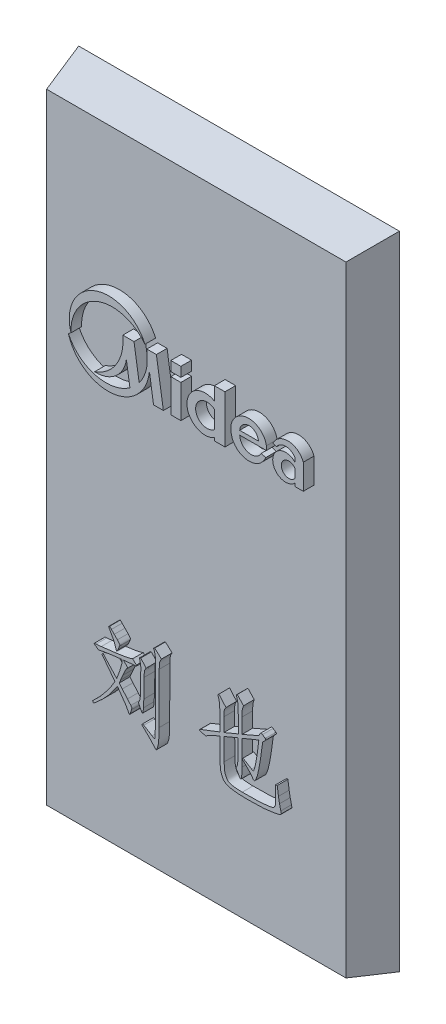
from build123d import *

# Parameters (mm, degrees)
EXTRUDE_3_DEPTH     = 1
SKETCH_5_R          = 5.5
CUT_EXTRUDE_1_DEPTH = 2
EXTRUDE_4_DEPTH     = 1
SKETCH_8_W          = 0.942568697
SKETCH_8_H          = 0.898055065
SKETCH_8_H_2        = 3.095520825
EXTRUDE_5_DEPTH     = 1


with BuildPart() as part:
    # 草图1 → 放样1 section 0
    with BuildSketch(Plane.XY):
        with BuildLine():
            Line((-15, -30), (15, -30))
            Line((15, -30), (15, 30))
            Line((15, 30), (-15, 30))
            Line((-15, 30), (-15, -30))
        make_face()
    # 草图2 → 放样1 section 1
    with BuildSketch(Plane.XY.offset(4)):
        with BuildLine():
            Line((-14, -29), (14, -29))
            Line((14, -29), (14, 29))
            Line((14, 29), (-14, 29))
            Line((-14, 29), (-14, -29))
        make_face()
    loft()

    # 草图4 → 凸台-拉伸3 (add)
    with BuildSketch(Plane.XY.offset(4)):
        with BuildLine():
            Line((-8.701981675, -17.388663968), (-8.617600682, -17.301725975))
            add(Edge.make_bspline(
                [(-8.617600682, -17.301725975), (-8.6150409, -17.299171838), (-8.607361553, -17.291509428), (-8.591939025, -17.275812111), (-8.567531532, -17.253359072), (-8.535647603, -17.222146979), (-8.494553267, -17.183979196), (-8.445204463, -17.138285053), (-8.386816782, -17.085481715), (-8.320576955, -17.024306793), (-8.246221878, -16.954193648), (-8.165436054, -16.873388622), (-8.079020214, -16.781225902), (-7.985588416, -16.679014982), (-7.886121691, -16.565894731), (-7.778094687, -16.443997551), (-7.666436292, -16.308719395), (-7.503591424, -16.115000087), (-7.298895179, -15.854174622), (-7.06301416, -15.517669226), (-6.830626913, -15.160132218), (-6.685534688, -14.909472229), (-6.611634349, -14.781802685)],
                knots=[0, 0, 0, 0, 0.067064899, 0.201194698, 0.408053647, 0.681959008, 1.028641223, 1.448132034, 1.929283414, 2.488604495, 3.120354818, 3.824536261, 4.607279378, 5.463251305, 6.392664243, 7.400870751, 8.483674113, 9.645406679, 12.094487374, 14.629448405, 17.264597856, 20, 20, 20, 20], degree=3))
            add(Edge.make_bspline(
                [(-6.611634349, -14.781802685), (-6.677355219, -14.694080325), (-6.801336137, -14.528594101), (-6.975046697, -14.293869871), (-7.128052851, -14.089741633), (-7.260480444, -13.915569528), (-7.369897523, -13.770279599), (-7.457376329, -13.654282983), (-7.526217285, -13.570571896), (-7.582699071, -13.497799136), (-7.635586412, -13.437186854), (-7.679234592, -13.378243521), (-7.712283472, -13.338932475), (-7.724576877, -13.315079833), (-7.729043256, -13.306413808)],
                knots=[0, 0, 0, 0, 2.13149326, 4.021013283, 5.678471046, 7.092298062, 8.275727547, 9.215558715, 9.917047241, 10.382981583, 11.006899411, 11.479347563, 11.810839116, 12, 12, 12, 12], degree=3))
            Line((-7.729043256, -13.306413808), (-7.824930748, -13.177285319))
            Line((-7.824930748, -13.177285319), (-7.729043256, -13.073726827))
            Line((-7.729043256, -13.073726827), (-7.644662263, -13.15938632))
            add(Edge.make_bspline(
                [(-7.644662263, -13.15938632), (-7.629282451, -13.175972122), (-7.591954382, -13.216227229), (-7.527305195, -13.288297956), (-7.440557184, -13.379422665), (-7.302378255, -13.536292511), (-7.104572099, -13.745740062), (-6.905065826, -13.963796689), (-6.747802954, -14.136718021), (-6.635049858, -14.252099447), (-6.536865705, -14.358806964), (-6.47286159, -14.423973045), (-6.442872363, -14.454506712)],
                knots=[0, 0, 0, 0, 0.384045172, 0.932109217, 1.643764177, 2.519898478, 4.481024401, 6.534588103, 7.538259206, 8.449228042, 9.273383417, 10, 10, 10, 10], degree=3))
            add(Edge.make_bspline(
                [(-6.442872363, -14.454506712), (-6.405201527, -14.35911478), (-6.332905522, -14.176043302), (-6.231843181, -13.912276932), (-6.149864716, -13.668866252), (-6.078665366, -13.450308489), (-6.024339358, -13.258168598), (-5.98424666, -13.096326335), (-5.956943752, -12.966798323), (-5.95252254, -12.890132643), (-5.950649904, -12.857660345)],
                knots=[0, 0, 0, 0, 1.468618142, 2.818499293, 4.043910366, 5.145864078, 6.10981738, 6.901638294, 7.534781031, 8, 8, 8, 8], degree=3))
            Line((-5.950649904, -12.857660345), (-5.950649904, -12.667163861))
            Line((-5.950649904, -12.667163861), (-6.972171319, -12.788621351))
            Line((-6.972171319, -12.788621351), (-7.451608779, -12.857660345))
            Line((-7.451608779, -12.857660345), (-7.956616237, -12.952269337))
            Line((-7.956616237, -12.952269337), (-8.16117622, -12.995738334))
            Line((-8.16117622, -12.995738334), (-8.232772214, -12.935648839))
            Line((-8.232772214, -12.935648839), (-8.485915193, -12.745152355))
            add(Edge.make_bspline(
                [(-8.485915193, -12.745152355), (-8.501489303, -12.73490888), (-8.526447886, -12.718493008), (-8.558458879, -12.694799587), (-8.557568147, -12.661889169), (-8.50827822, -12.649271695), (-8.449453901, -12.63496461), (-8.393937078, -12.628338983), (-8.365736203, -12.624973365)],
                knots=[0, 0, 0, 0, 1.118768377, 1.792903396, 2.169548065, 2.763492425, 4.355951528, 6, 6, 6, 6], degree=3))
            Line((-8.365736203, -12.624973365), (-7.885020243, -12.590453867))
            add(Edge.make_bspline(
                [(-7.885020243, -12.590453867), (-7.78272737, -12.578629672), (-7.574258285, -12.5545324), (-7.256024754, -12.515654208), (-6.925643087, -12.476441077), (-6.701543082, -12.448642762), (-6.587342851, -12.43447688)],
                knots=[0, 0, 0, 0, 0.945420497, 1.926731945, 2.943473063, 4, 4, 4, 4], degree=3))
            add(Edge.make_bspline(
                [(-6.587342851, -12.43447688), (-6.495657729, -12.423413493), (-6.318882537, -12.402082524), (-6.064664904, -12.364158296), (-5.830515798, -12.327688901), (-5.617264447, -12.28984122), (-5.424834911, -12.249462361), (-5.25244094, -12.211336739), (-5.101225844, -12.169009917), (-5.008293553, -12.13818563), (-4.964926486, -12.123801406)],
                knots=[0, 0, 0, 0, 1.33948248, 2.582613925, 3.727962399, 4.776813962, 5.723648299, 6.579883267, 7.337299279, 8, 8, 8, 8], degree=3))
            Line((-4.964926486, -12.123801406), (-4.592883017, -12.44342638))
            add(Edge.make_bspline(
                [(-4.592883017, -12.44342638), (-4.586313661, -12.454610374), (-4.573704208, -12.476077324), (-4.578676747, -12.511884126), (-4.596688819, -12.541911053), (-4.618071593, -12.545302265), (-4.628681014, -12.546984871)],
                knots=[0, 0, 0, 0, 1.123791349, 2.157044512, 3.08558681, 4, 4, 4, 4], degree=3))
            Line((-4.628681014, -12.546984871), (-5.193777967, -12.590453867))
            Line((-5.193777967, -12.590453867), (-5.793394417, -12.650543362))
            Line((-5.793394417, -12.650543362), (-5.409844449, -13.099296825))
            add(Edge.make_bspline(
                [(-5.409844449, -13.099296825), (-5.449499903, -13.136079122), (-5.524000558, -13.205181979), (-5.587303376, -13.301744233), (-5.61998484, -13.37159487), (-5.641445696, -13.416701743), (-5.666890063, -13.471734749), (-5.696865722, -13.536256466), (-5.729756683, -13.61142488), (-5.766306518, -13.697074488), (-5.809177744, -13.791622756), (-5.838230924, -13.858260359), (-5.853483912, -13.893245259)],
                knots=[0, 0, 0, 0, 1.762639404, 3.311468555, 3.728776672, 4.283189535, 4.943599157, 5.710021754, 6.607881863, 7.624557154, 8.752886879, 10, 10, 10, 10], degree=3))
            Line((-5.853483912, -13.893245259), (-6.082335393, -14.411037716))
            Line((-6.082335393, -14.411037716), (-6.214020882, -14.712763691))
            Line((-6.214020882, -14.712763691), (-5.926358406, -15.049009163))
            Line((-5.926358406, -15.049009163), (-5.434135947, -15.610270616))
            Line((-5.434135947, -15.610270616), (-5.120903473, -15.973364586))
            add(Edge.make_bspline(
                [(-5.120903473, -15.973364586), (-5.108508398, -15.990363114), (-5.086163173, -16.021007216), (-5.056993841, -16.062275096), (-5.040222812, -16.096032898), (-5.029672316, -16.123584455), (-5.031655384, -16.152962114), (-5.034721662, -16.189376311), (-5.04632312, -16.236994653), (-5.055631797, -16.272143528), (-5.060813978, -16.291711059)],
                knots=[0, 0, 0, 0, 1.455215602, 2.623390349, 3.479583614, 4.066449285, 4.626074215, 5.48479686, 6.599775501, 8, 8, 8, 8], degree=3))
            Line((-5.060813978, -16.291711059), (-5.169486469, -16.663754528))
            add(Edge.make_bspline(
                [(-5.169486469, -16.663754528), (-5.174174993, -16.677157718), (-5.18246774, -16.700864381), (-5.198745873, -16.729886481), (-5.216901029, -16.749122095), (-5.238951481, -16.755125572), (-5.261594893, -16.748983909), (-5.282282348, -16.729450325), (-5.305362329, -16.7015698), (-5.3182664, -16.677293999), (-5.325463456, -16.663754528)],
                knots=[0, 0, 0, 0, 1.365122435, 2.414536923, 3.199116316, 3.836643909, 4.513934304, 5.360547298, 6.527884014, 8, 8, 8, 8], degree=3))
            Line((-5.325463456, -16.663754528), (-5.421350948, -16.482207543))
            Line((-5.421350948, -16.482207543), (-5.565821436, -16.215001065))
            add(Edge.make_bspline(
                [(-5.565821436, -16.215001065), (-5.572208548, -16.205622117), (-5.588244401, -16.182074784), (-5.616983427, -16.140250866), (-5.658060685, -16.086621593), (-5.705063521, -16.017726276), (-5.763659301, -15.936783591), (-5.830878889, -15.842211073), (-5.90903839, -15.735248117), (-5.992876265, -15.619552174), (-6.075177782, -15.503789732), (-6.150436469, -15.397555707), (-6.216408063, -15.305904078), (-6.26928579, -15.226623912), (-6.312977006, -15.16243407), (-6.347040873, -15.11293019), (-6.368573488, -15.076247309), (-6.378991259, -15.056277349), (-6.382782868, -15.049009163)],
                knots=[0, 0, 0, 0, 0.382459276, 0.960224421, 1.710024245, 2.658454337, 3.770494442, 5.077894009, 6.569008607, 8.235429148, 9.893471766, 11.356158959, 12.623493842, 13.699131709, 14.567622413, 15.240873571, 15.723711415, 16, 16, 16, 16], degree=3))
            add(Edge.make_bspline(
                [(-6.382782868, -15.049009163), (-6.416909498, -15.100552505), (-6.482944033, -15.200288127), (-6.578062572, -15.345140635), (-6.670026744, -15.477861724), (-6.753098386, -15.60222334), (-6.833596009, -15.714430579), (-6.905249148, -15.8183162), (-6.973635526, -15.91004722), (-7.058115277, -16.023697045), (-7.173217897, -16.167150414), (-7.334311928, -16.346177935), (-7.520572626, -16.54609202), (-7.728276888, -16.75445262), (-7.936900177, -16.959762036), (-8.134192485, -17.142216407), (-8.308601908, -17.29845862), (-8.42121459, -17.389077999), (-8.473130194, -17.430854464)],
                knots=[0, 0, 0, 0, 0.931745548, 1.802914179, 2.611776586, 3.365396291, 4.056858392, 4.693065683, 5.267339538, 5.781210556, 6.827513186, 8.037874439, 9.410316573, 10.945546555, 12.471773758, 13.821678912, 14.99577158, 16, 16, 16, 16], degree=3))
            Line((-8.473130194, -17.430854464), (-8.606094183, -17.534412955))
            Line((-8.606094183, -17.534412955), (-8.701981675, -17.388663968))
        make_face()
        with BuildLine():
            Line((-7.211250799, -10.630513531), (-7.103856808, -10.553803537))
            Line((-7.103856808, -10.553803537), (-6.935094822, -10.726401023))
            Line((-6.935094822, -10.726401023), (-6.671723844, -10.993607501))
            Line((-6.671723844, -10.993607501), (-6.382782868, -11.295333475))
            add(Edge.make_bspline(
                [(-6.382782868, -11.295333475), (-6.364016122, -11.315776091), (-6.328925502, -11.354000303), (-6.279962873, -11.407778928), (-6.238808393, -11.454933426), (-6.206100395, -11.495820497), (-6.179781755, -11.528336484), (-6.163263547, -11.554924513), (-6.151359602, -11.573453422), (-6.145792904, -11.602262853), (-6.166926085, -11.650051026), (-6.181777032, -11.692273105), (-6.191007884, -11.71851694)],
                knots=[0, 0, 0, 0, 1.619185606, 3.027601398, 4.244025609, 5.269295413, 6.084975465, 6.67813271, 7.10086228, 7.354451259, 8.355615234, 10, 10, 10, 10], degree=3))
            Line((-6.191007884, -11.71851694), (-6.311186874, -12.029192414))
            add(Edge.make_bspline(
                [(-6.311186874, -12.029192414), (-6.321417975, -12.053246865), (-6.339637715, -12.096083488), (-6.369175367, -12.150574851), (-6.394959287, -12.188922038), (-6.420692917, -12.212351984), (-6.449964905, -12.215095714), (-6.472643068, -12.194654532), (-6.489438739, -12.160245395), (-6.497947711, -12.131683057), (-6.502961858, -12.114851907)],
                knots=[0, 0, 0, 0, 1.766026744, 3.144973943, 4.176047435, 4.895969722, 5.415113065, 5.991050895, 6.816171035, 8, 8, 8, 8], degree=3))
            Line((-6.502961858, -12.114851907), (-6.527253356, -12.029192414))
            add(Edge.make_bspline(
                [(-6.527253356, -12.029192414), (-6.565462786, -11.913018959), (-6.64149182, -11.681857287), (-6.749621634, -11.463861832), (-6.803409333, -11.35542297)],
                knots=[0, 0, 0, 0, 1.005127315, 2, 2, 2, 2], degree=3))
            Line((-6.803409333, -11.35542297), (-6.972171319, -11.053696996))
            add(Edge.make_bspline(
                [(-6.972171319, -11.053696996), (-6.993300524, -11.01673679), (-7.030051629, -10.952450019), (-7.07406915, -10.869103457), (-7.103723446, -10.815099763), (-7.112566488, -10.786565613), (-7.115363307, -10.777541019)],
                knots=[0, 0, 0, 0, 1.639141311, 2.851042099, 3.636615117, 4, 4, 4, 4], degree=3))
            Line((-7.115363307, -10.777541019), (-7.211250799, -10.630513531))
        make_face()
        with BuildLine():
            Line((-4.31544854, -11.727466439), (-4.19526955, -11.675047944))
            Line((-4.19526955, -11.675047944), (-3.691540592, -12.245258896))
            add(Edge.make_bspline(
                [(-3.691540592, -12.245258896), (-3.709810323, -12.2727357), (-3.743306609, -12.323112515), (-3.783569559, -12.394330478), (-3.813704395, -12.452101199), (-3.834694025, -12.516023227), (-3.847448468, -12.59699214), (-3.86001522, -12.684347934), (-3.866041286, -12.771519098), (-3.870153354, -12.858037951), (-3.87038165, -12.963355521), (-3.871309223, -13.040061953), (-3.871809077, -13.081397827)],
                knots=[0, 0, 0, 0, 1.131244594, 2.0740586, 2.806258543, 3.36096166, 4.37296763, 5.611338802, 6.388280779, 7.368648685, 8.582006723, 10, 10, 10, 10], degree=3))
            Line((-3.871809077, -13.081397827), (-3.907607074, -14.859791178))
            Line((-3.907607074, -14.859791178), (-3.943405071, -15.584700618))
            add(Edge.make_bspline(
                [(-3.943405071, -15.584700618), (-3.945337151, -15.617956796), (-3.948981312, -15.680682431), (-3.95706597, -15.768414138), (-3.964171003, -15.844825772), (-3.973350685, -15.90913213), (-3.981514107, -15.961795872), (-3.991691865, -16.002621639), (-4.002479425, -16.031402593), (-4.01557264, -16.054962993), (-4.04649104, -16.064029303), (-4.079703401, -16.034802266), (-4.114163474, -15.988274594), (-4.135459361, -15.945855862), (-4.147965054, -15.92094609)],
                knots=[0, 0, 0, 0, 1.76302463, 3.325302124, 4.663004508, 5.824175704, 6.762377734, 7.484540761, 8.041647273, 8.39829817, 8.869293458, 9.507688602, 10.536427081, 12, 12, 12, 12], degree=3))
            Line((-4.147965054, -15.92094609), (-4.255359045, -15.713829107))
            Line((-4.255359045, -15.713829107), (-4.352525037, -15.532282122))
            add(Edge.make_bspline(
                [(-4.352525037, -15.532282122), (-4.365405618, -15.507749536), (-4.386757968, -15.467081464), (-4.402824564, -15.412835847), (-4.395966719, -15.373877463), (-4.383846398, -15.34036551), (-4.365738625, -15.298101457), (-4.326896416, -15.231664451), (-4.282712631, -15.130473075), (-4.25294185, -14.987201603), (-4.235786887, -14.823160753), (-4.233540193, -14.705998092), (-4.232346047, -14.643724696)],
                knots=[0, 0, 0, 0, 0.901925096, 1.495136018, 1.774437093, 2.167492218, 2.649873968, 3.26160492, 4.659748266, 6.204185153, 7.982477734, 10, 10, 10, 10], degree=3))
            Line((-4.232346047, -14.643724696), (-4.19526955, -12.814191349))
            Line((-4.19526955, -12.814191349), (-4.183763051, -12.44342638))
            add(Edge.make_bspline(
                [(-4.183763051, -12.44342638), (-4.18831572, -12.402924774), (-4.198826597, -12.309417557), (-4.215744817, -12.184916485), (-4.235127336, -12.066005847), (-4.255291323, -11.96181072), (-4.282481032, -11.84759475), (-4.304121749, -11.768739449), (-4.31544854, -11.727466439)],
                knots=[0, 0, 0, 0, 1.006347927, 2.323384265, 3.101860361, 3.981004873, 4.943254252, 6, 6, 6, 6], degree=3))
        make_face()
        with BuildLine():
            Line((-2.886085659, -10.216279565), (-2.260899212, -10.795440017))
            add(Edge.make_bspline(
                [(-2.260899212, -10.795440017), (-2.27897721, -10.825593177), (-2.31186996, -10.88045657), (-2.353740762, -10.955684025), (-2.385079585, -11.013972945), (-2.406156719, -11.061201132), (-2.418307524, -11.107926684), (-2.429878104, -11.162874149), (-2.439530387, -11.231674601), (-2.451791638, -11.345356064), (-2.462447745, -11.509089806), (-2.464411029, -11.645623695), (-2.465459195, -11.71851694)],
                knots=[0, 0, 0, 0, 1.09355359, 1.989710599, 2.677512757, 3.152714002, 3.593377568, 4.175755165, 4.899414449, 5.752884475, 7.732533383, 10, 10, 10, 10], degree=3))
            Line((-2.465459195, -11.71851694), (-2.489750693, -16.464308545))
            add(Edge.make_bspline(
                [(-2.489750693, -16.464308545), (-2.489682191, -16.492009645), (-2.489529374, -16.553807072), (-2.490975351, -16.656519076), (-2.4938808, -16.778813349), (-2.496965577, -16.96890006), (-2.502164021, -17.223356379), (-2.509750918, -17.482641294), (-2.523924139, -17.690403365), (-2.543112578, -17.841690607), (-2.577602355, -17.986608757), (-2.61808336, -18.120197835), (-2.659407718, -18.233941254), (-2.695694125, -18.314965002), (-2.715146911, -18.36969669), (-2.735761473, -18.38529897), (-2.741615172, -18.389729384)],
                knots=[0, 0, 0, 0, 0.591697287, 1.319996994, 2.194077997, 3.204678908, 5.380780365, 7.630722164, 8.744310266, 9.828297922, 10.883818306, 11.920525732, 12.813365975, 13.454079988, 13.844980897, 14, 14, 14, 14], degree=3))
            add(Edge.make_bspline(
                [(-2.741615172, -18.389729384), (-2.748580604, -18.386552763), (-2.770203473, -18.376691542), (-2.805730246, -18.342781364), (-2.857676356, -18.290296374), (-2.898439287, -18.248716896), (-2.921883657, -18.224802898)],
                knots=[0, 0, 0, 0, 0.372665578, 1.156869871, 2.364803703, 4, 4, 4, 4], degree=3))
            Line((-2.921883657, -18.224802898), (-3.35529512, -17.750479437))
            Line((-3.35529512, -17.750479437), (-3.967696569, -17.154698487))
            Line((-3.967696569, -17.154698487), (-4.099382058, -17.008949499))
            Line((-4.099382058, -17.008949499), (-4.003494566, -16.905391008))
            Line((-4.003494566, -16.905391008), (-3.907607074, -16.974430002))
            Line((-3.907607074, -16.974430002), (-3.137950139, -17.448753463))
            add(Edge.make_bspline(
                [(-3.137950139, -17.448753463), (-3.107846641, -17.467453432), (-3.055614578, -17.499899429), (-2.987095797, -17.54194895), (-2.943047018, -17.562424533), (-2.912447329, -17.578564787), (-2.894380813, -17.563642034), (-2.884389813, -17.541037572), (-2.870955086, -17.507974371), (-2.865124564, -17.480861102), (-2.861794162, -17.465373961)],
                knots=[0, 0, 0, 0, 2.231975484, 3.872662471, 4.948167798, 5.447359977, 5.773533116, 6.264068126, 7.008433082, 8, 8, 8, 8], degree=3))
            add(Edge.make_bspline(
                [(-2.861794162, -17.465373961), (-2.858514906, -17.447512726), (-2.850750002, -17.405219364), (-2.858581596, -17.328530112), (-2.859413733, -17.227473124), (-2.851781312, -17.137658333), (-2.847727937, -17.0638988), (-2.843092015, -17.012428916), (-2.84163978, -16.949676316), (-2.836799089, -16.876886425), (-2.834870732, -16.792882265), (-2.832612814, -16.698680605), (-2.827953876, -16.593893276), (-2.826668572, -16.520567804), (-2.825996165, -16.482207543)],
                knots=[0, 0, 0, 0, 0.661127957, 1.565475392, 2.796625909, 4.357721855, 4.857348772, 5.497957161, 6.246587067, 7.151605532, 8.164975693, 9.318533995, 10.597189571, 12, 12, 12, 12], degree=3))
            Line((-2.825996165, -16.482207543), (-2.801704667, -11.545919455))
            add(Edge.make_bspline(
                [(-2.801704667, -11.545919455), (-2.801760094, -11.519481806), (-2.801871949, -11.466129504), (-2.807924708, -11.396797206), (-2.810607971, -11.332810947), (-2.815391131, -11.270252602), (-2.816801137, -11.193025953), (-2.822487079, -11.073272995), (-2.829012882, -10.921239192), (-2.843980556, -10.769848285), (-2.868264302, -10.646533474), (-2.89965208, -10.540449213), (-2.942670187, -10.417885881), (-2.976551583, -10.331655482), (-2.99475815, -10.28531856)],
                knots=[0, 0, 0, 0, 0.739991118, 1.493333668, 1.947445289, 2.533295858, 3.249720848, 4.109699155, 5.890394751, 7.51137051, 8.363279193, 9.405830689, 10.605992517, 12, 12, 12, 12], degree=3))
            Line((-2.99475815, -10.28531856), (-2.886085659, -10.216279565))
        make_face()
        with BuildLine():
            Line((3.210824632, -13.962284253), (3.210824632, -12.374387385))
            add(Edge.make_bspline(
                [(3.210824632, -12.374387385), (3.209126434, -12.271656981), (3.205655579, -12.06169196), (3.187606357, -11.795820456), (3.159876337, -11.575337912), (3.126662955, -11.402164237), (3.07905803, -11.224205556), (3.038507103, -11.105465778), (3.017771149, -11.044747496)],
                knots=[0, 0, 0, 0, 1.368881025, 2.797780605, 3.547867927, 4.328518173, 5.145277974, 6, 6, 6, 6], degree=3))
            Line((3.017771149, -11.044747496), (3.11493714, -10.941189005))
            Line((3.11493714, -10.941189005), (3.774643085, -11.700617942))
            add(Edge.make_bspline(
                [(3.774643085, -11.700617942), (3.758326503, -11.725251518), (3.72796582, -11.771087843), (3.687480246, -11.836093473), (3.657878594, -11.893945094), (3.627944587, -11.964767706), (3.607082509, -12.067445774), (3.592483254, -12.208639878), (3.584038135, -12.372591178), (3.583265573, -12.487741703), (3.582868101, -12.546984871)],
                knots=[0, 0, 0, 0, 0.799333978, 1.487341208, 2.069922442, 2.555870397, 3.562491356, 4.885176502, 6.397471374, 8, 8, 8, 8], degree=3))
            Line((3.582868101, -12.546984871), (3.582868101, -13.824206265))
            Line((3.582868101, -13.824206265), (4.929128489, -13.262944811))
            Line((4.929128489, -13.262944811), (4.929128489, -11.753036437))
            add(Edge.make_bspline(
                [(4.929128489, -11.753036437), (4.92858556, -11.691244836), (4.927548375, -11.573201294), (4.927892338, -11.404804507), (4.921425798, -11.253992254), (4.915833818, -11.079927224), (4.901987045, -10.885380488), (4.875754526, -10.70123617), (4.846282377, -10.559098647), (4.815991848, -10.44684633), (4.781186889, -10.325153143), (4.751489744, -10.242540414), (4.736075005, -10.199659067)],
                knots=[0, 0, 0, 0, 1.176911092, 2.248311282, 3.206600744, 4.051334116, 5.565261425, 6.918565952, 7.590320494, 8.328559244, 9.132414199, 10, 10, 10, 10], degree=3))
            Line((4.736075005, -10.199659067), (4.831962497, -10.112721074))
            Line((4.831962497, -10.112721074), (5.421350948, -10.734072022))
            add(Edge.make_bspline(
                [(5.421350948, -10.734072022), (5.408322526, -10.770211237), (5.383317544, -10.839571927), (5.351239432, -10.940628433), (5.325704556, -11.034024238), (5.303827308, -11.126182054), (5.29141719, -11.231984471), (5.283519325, -11.364266474), (5.276614903, -11.530086504), (5.276786754, -11.652026137), (5.27688046, -11.71851694)],
                knots=[0, 0, 0, 0, 0.919393691, 1.76455914, 2.536580374, 3.236881176, 4.028858006, 5.081856361, 6.408805183, 8, 8, 8, 8], degree=3))
            Line((5.27688046, -11.71851694), (5.27688046, -13.124866823))
            Line((5.27688046, -13.124866823), (6.827700831, -12.452375879))
            Line((6.827700831, -12.452375879), (7.019475815, -12.158320903))
            add(Edge.make_bspline(
                [(7.019475815, -12.158320903), (7.026703946, -12.148697104), (7.041507275, -12.128987408), (7.086030215, -12.128122667), (7.134752872, -12.147887327), (7.168626298, -12.170689347), (7.188237801, -12.183890901)],
                knots=[0, 0, 0, 0, 0.71453755, 1.463384476, 2.53139035, 4, 4, 4, 4], degree=3))
            Line((7.188237801, -12.183890901), (7.44010228, -12.374387385))
            add(Edge.make_bspline(
                [(7.44010228, -12.374387385), (7.456409708, -12.388950822), (7.484511329, -12.414047126), (7.499338251, -12.463386598), (7.482078066, -12.498937399), (7.458599113, -12.532898791), (7.416909429, -12.570821509), (7.368574387, -12.61700621), (7.316558293, -12.66066125), (7.273659526, -12.702873709), (7.241348343, -12.736242921), (7.21701738, -12.763028278), (7.208110051, -12.796607746), (7.197737652, -12.840710682), (7.1853454, -12.906928354), (7.171491916, -12.995155013), (7.156693918, -13.104841442), (7.138517192, -13.236055278), (7.117949326, -13.388985313), (7.090185505, -13.615805341), (7.057078191, -13.895783521), (7.012200307, -14.20829562), (6.973202819, -14.482784302), (6.930564858, -14.72147271), (6.891685116, -14.932838148), (6.854222441, -15.124032539), (6.8204412, -15.299942354), (6.785589875, -15.460139588), (6.75147321, -15.607093542), (6.714601925, -15.742081558), (6.673630702, -15.866106051), (6.630965981, -15.977511831), (6.590073801, -16.073390324), (6.556322534, -16.151155796), (6.52798116, -16.209509469), (6.502502392, -16.25649485), (6.470291137, -16.298824211), (6.434831686, -16.300083455), (6.418580865, -16.300660558)],
                knots=[0, 0, 0, 0, 0.559111769, 0.963484084, 1.199679221, 1.54642562, 2.027141703, 2.640108529, 3.269336219, 3.773372396, 4.184380251, 4.473866774, 4.681914613, 5.06490853, 5.645540527, 6.411685309, 7.363818343, 8.492742829, 9.820197465, 11.333935145, 14.372292433, 17.073622702, 19.457084914, 21.504944609, 23.311490023, 24.986709407, 26.517821523, 27.920066707, 29.204667356, 30.399106788, 31.519103026, 32.563782659, 33.467986644, 34.199448975, 34.748689143, 35.126785844, 35.59981199, 36, 36, 36, 36], degree=3))
            add(Edge.make_bspline(
                [(6.418580865, -16.300660558), (6.409816095, -16.299120895), (6.389730733, -16.2955926), (6.361018096, -16.272946221), (6.329957172, -16.239895489), (6.309607694, -16.212298734), (6.298401875, -16.197102067)],
                knots=[0, 0, 0, 0, 0.646680353, 1.481933883, 2.613379931, 4, 4, 4, 4], degree=3))
            Line((6.298401875, -16.197102067), (5.973662902, -15.791817601))
            Line((5.973662902, -15.791817601), (5.613125932, -15.421052632))
            Line((5.613125932, -15.421052632), (5.301171958, -15.126997656))
            Line((5.301171958, -15.126997656), (5.372767952, -14.997869167))
            Line((5.372767952, -14.997869167), (6.178222885, -15.490091626))
            add(Edge.make_bspline(
                [(6.178222885, -15.490091626), (6.194648608, -15.501452728), (6.223636396, -15.521502575), (6.263939359, -15.544300169), (6.292140741, -15.559916984), (6.316588627, -15.565606088), (6.337826073, -15.551900936), (6.356216812, -15.525312045), (6.377768277, -15.484375663), (6.405013145, -15.426588416), (6.435086831, -15.342078206), (6.466498512, -15.224546279), (6.505581258, -15.071791979), (6.559629335, -14.822391743), (6.627938588, -14.494438642), (6.679128713, -14.166876704), (6.712451994, -13.922564919), (6.736216622, -13.763771542), (6.754851776, -13.626833399), (6.773152012, -13.502512968), (6.791650807, -13.370998623), (6.808587871, -13.212279497), (6.829172257, -13.017111291), (6.843144072, -12.874717856), (6.850713829, -12.79757085)],
                knots=[0, 0, 0, 0, 0.440323242, 0.777073662, 1.016577932, 1.15873692, 1.297439592, 1.538046727, 1.870179391, 2.315683085, 2.945720451, 3.843830757, 4.996709113, 6.421182702, 9.468416178, 12.379641864, 13.726774567, 14.903855726, 15.918856624, 16.773102867, 17.673862327, 18.846135373, 20.291275087, 22, 22, 22, 22], degree=3))
            Line((6.850713829, -12.79757085), (5.265373961, -13.444491796))
            Line((5.265373961, -13.444491796), (5.265373961, -15.791817601))
            add(Edge.make_bspline(
                [(5.265373961, -15.791817601), (5.265651609, -15.854466389), (5.266174824, -15.972525423), (5.262737996, -16.139142222), (5.260821378, -16.284490155), (5.256968943, -16.408939518), (5.252241525, -16.512134297), (5.245890952, -16.594396297), (5.239366722, -16.655676085), (5.228165992, -16.706277228), (5.212924944, -16.748283526), (5.195840814, -16.782707572), (5.178343387, -16.807366528), (5.163005445, -16.808881042), (5.15670147, -16.809503516)],
                knots=[0, 0, 0, 0, 2.150659061, 4.052827516, 5.720942216, 7.140763154, 8.327264278, 9.266458778, 9.974179908, 10.439139188, 11.045371919, 11.490336149, 11.790525499, 12, 12, 12, 12], degree=3))
            add(Edge.make_bspline(
                [(5.15670147, -16.809503516), (5.145084644, -16.806090327), (5.115477873, -16.797391438), (5.079860637, -16.750467384), (5.03411576, -16.687163889), (5.00555075, -16.633226562), (4.989217984, -16.602386533)],
                knots=[0, 0, 0, 0, 0.521855015, 1.330005405, 2.473363152, 4, 4, 4, 4], degree=3))
            Line((4.989217984, -16.602386533), (4.831962497, -16.318559557))
            add(Edge.make_bspline(
                [(4.831962497, -16.318559557), (4.816647756, -16.292605327), (4.789719584, -16.24696956), (4.754513798, -16.187356703), (4.736850566, -16.14424678), (4.726676087, -16.112382083), (4.737698822, -16.086419896), (4.74847026, -16.055251845), (4.766358044, -16.014895421), (4.792389019, -15.966324018), (4.818368235, -15.903962994), (4.840282152, -15.826694947), (4.859466062, -15.734353684), (4.874221519, -15.632559334), (4.888087211, -15.531143226), (4.897628983, -15.441089287), (4.906229205, -15.367479809), (4.910466321, -15.300917129), (4.912987062, -15.222899108), (4.915654365, -15.115933767), (4.916598437, -14.970595453), (4.916435041, -14.861069343), (4.91634349, -14.799701683)],
                knots=[0, 0, 0, 0, 1.153316831, 2.027896723, 2.626604535, 2.958707876, 3.24723816, 3.664596661, 4.233327129, 4.925102638, 5.771803346, 6.807388563, 7.988979107, 9.373009111, 10.736290758, 11.899678417, 12.832920397, 13.567268629, 14.447137605, 15.815272531, 17.655290347, 20, 20, 20, 20], degree=3))
            Line((4.91634349, -14.799701683), (4.91634349, -13.582569785))
            Line((4.91634349, -13.582569785), (3.5943746, -14.134881739))
            Line((3.5943746, -14.134881739), (3.607159599, -16.188152568))
            add(Edge.make_bspline(
                [(3.607159599, -16.188152568), (3.609155134, -16.284053774), (3.613328035, -16.484594624), (3.628018181, -16.739684973), (3.658403283, -16.954775715), (3.708894856, -17.120409554), (3.779909349, -17.287863294), (3.8493934, -17.431707783), (3.937255351, -17.541708253), (4.041768254, -17.608686369), (4.174288903, -17.66793349), (4.339417769, -17.712353392), (4.53435378, -17.751593078), (4.762088112, -17.774427082), (5.02090097, -17.7920111), (5.204392162, -17.793279457), (5.301171958, -17.793948434)],
                knots=[0, 0, 0, 0, 1.425456696, 2.980799826, 3.795017339, 4.646697254, 5.544056949, 6.498866747, 7.011340332, 7.612152063, 8.320781704, 9.164607943, 10.145811148, 11.273905285, 12.562160463, 14, 14, 14, 14], degree=3))
            add(Edge.make_bspline(
                [(5.301171958, -17.793948434), (5.470789115, -17.794515515), (5.804503094, -17.79563122), (6.297213468, -17.787554868), (6.774213208, -17.772892278), (7.15857007, -17.752473046), (7.447605944, -17.73307115), (7.6382032, -17.714011088), (7.8043043, -17.691920919), (7.945776182, -17.664672643), (8.063545394, -17.637033396), (8.156964339, -17.603728141), (8.228035826, -17.569073121), (8.286855914, -17.514670336), (8.330260992, -17.44272668), (8.374041165, -17.363231496), (8.402674496, -17.284695978), (8.409655582, -17.232450653), (8.413040699, -17.207116983)],
                knots=[0, 0, 0, 0, 2.420504351, 4.762231322, 7.03186758, 9.2303889, 10.254712443, 11.165461446, 11.963621161, 12.644686658, 13.221420043, 13.686975695, 14.059747789, 14.339570671, 14.816933281, 15.24945927, 15.636064052, 16, 16, 16, 16], degree=3))
            Line((8.413040699, -17.207116983), (8.425825698, -15.635840614))
            Line((8.425825698, -15.635840614), (8.569017686, -15.619220115))
            Line((8.569017686, -15.619220115), (8.689196676, -16.438738547))
            Line((8.689196676, -16.438738547), (8.786362668, -16.991050501))
            Line((8.786362668, -16.991050501), (8.906541658, -17.508842958))
            add(Edge.make_bspline(
                [(8.906541658, -17.508842958), (8.908298872, -17.526376634), (8.912419079, -17.567488534), (8.928010183, -17.628304071), (8.946344796, -17.68162792), (8.951917027, -17.713778718), (8.953846154, -17.72490944)],
                knots=[0, 0, 0, 0, 0.953220718, 2.235054002, 3.388969388, 4, 4, 4, 4], degree=3))
            add(Edge.make_bspline(
                [(8.953846154, -17.72490944), (8.950069463, -17.736983143), (8.941712863, -17.763698363), (8.904645101, -17.795045339), (8.856434737, -17.82724415), (8.789371367, -17.855267017), (8.707715764, -17.884867177), (8.608460275, -17.912549262), (8.492372402, -17.939047729), (8.317130483, -17.971835273), (8.091894188, -18.009785756), (7.825098208, -18.045368552), (7.569274082, -18.078985841), (7.359310107, -18.098316431), (7.186183001, -18.110551033), (7.041252135, -18.117909869), (6.879727276, -18.124408997), (6.70198161, -18.128874983), (6.507684288, -18.134990279), (6.29669265, -18.136283727), (6.069134417, -18.139943667), (5.911870583, -18.139416346), (5.830470914, -18.139143405)],
                knots=[0, 0, 0, 0, 0.232926519, 0.515391414, 0.878795428, 1.325768791, 1.869100865, 2.508894764, 3.255029941, 4.101143149, 5.850638678, 7.536402802, 9.14670046, 10.687374927, 11.488261288, 12.400303648, 13.407749454, 14.51872378, 15.733519881, 17.051853478, 18.474041082, 20, 20, 20, 20], degree=3))
            add(Edge.make_bspline(
                [(5.830470914, -18.139143405), (5.749499846, -18.139378112), (5.591382586, -18.13983644), (5.360320443, -18.136582645), (5.141722252, -18.126795164), (4.935319262, -18.116184546), (4.741261185, -18.099891372), (4.559842862, -18.07740414), (4.390691678, -18.054235165), (4.234594957, -18.024596436), (4.091014932, -17.991286754), (3.960984602, -17.94893976), (3.843915713, -17.899325014), (3.74012297, -17.84200252), (3.649680107, -17.778015545), (3.572517953, -17.706759318), (3.509301087, -17.627469309), (3.447456445, -17.513961696), (3.388881158, -17.37449272), (3.328227496, -17.217719964), (3.287009221, -17.074340979), (3.260759296, -16.939508324), (3.249330552, -16.801128193), (3.240759072, -16.64807565), (3.233684411, -16.473317947), (3.233784497, -16.349677339), (3.233837631, -16.28404006)],
                knots=[0, 0, 0, 0, 1.518911959, 2.966074195, 4.334239857, 5.623327299, 6.842892953, 7.986185861, 9.05230548, 10.044787367, 10.965795675, 11.815222499, 12.606695946, 13.347450692, 14.035144098, 14.679960432, 15.31171039, 15.927477056, 17.09794899, 18.147758735, 19.078945764, 19.892674845, 20.719956626, 21.68090022, 22.768855931, 24, 24, 24, 24], degree=3))
            Line((3.233837631, -16.28404006), (3.222331131, -14.289580226))
            add(Edge.make_bspline(
                [(3.222331131, -14.289580226), (3.159695497, -14.315601661), (3.040781697, -14.365003374), (2.871626836, -14.434819669), (2.722994747, -14.499134877), (2.593460017, -14.553589381), (2.484240181, -14.601604607), (2.394031785, -14.640580012), (2.323583949, -14.672308254), (2.254988923, -14.705658648), (2.17860888, -14.74665373), (2.088638186, -14.806853655), (1.989717119, -14.87517737), (1.923522055, -14.927171092), (1.888855743, -14.95440017)],
                knots=[0, 0, 0, 0, 1.631833046, 3.098036258, 4.40260852, 5.528124467, 6.478632526, 7.272971962, 7.892419543, 8.33722278, 9.108053839, 9.975462267, 10.9397509, 12, 12, 12, 12], degree=3))
            Line((1.888855743, -14.95440017), (1.383848285, -14.816322182))
            add(Edge.make_bspline(
                [(1.383848285, -14.816322182), (1.371256566, -14.813541672), (1.349110971, -14.808651471), (1.321910173, -14.794053216), (1.302807026, -14.775950203), (1.297801439, -14.751917852), (1.303225753, -14.727242926), (1.321967909, -14.705700487), (1.34822781, -14.684206509), (1.37110556, -14.674629187), (1.383848285, -14.669294694)],
                knots=[0, 0, 0, 0, 1.286068791, 2.261864203, 3.078608935, 3.825212105, 4.613490036, 5.528387975, 6.623331777, 8, 8, 8, 8], degree=3))
            Line((1.383848285, -14.669294694), (3.210824632, -13.962284253))
        make_face()
    extrude(amount=EXTRUDE_3_DEPTH)

    # 草图5 → 切除-拉伸1 (cut)
    with BuildSketch(Plane(origin=(0, 0, 0), x_dir=(-1, 0, 0), z_dir=(0, 0, -1))):
        Circle(SKETCH_5_R)
        with Locations((0, 18)):
            Circle(SKETCH_5_R)
        with Locations((0, -18)):
            Circle(SKETCH_5_R)
    extrude(amount=-CUT_EXTRUDE_1_DEPTH, mode=Mode.SUBTRACT)

    # 草图7 → 凸台-拉伸4 (add)
    with BuildSketch(Plane.XY.offset(4)):
        with BuildLine():
            Line((3.210824632, -13.962284253), (1.383848285, -14.669294694))
            add(Edge.make_bspline(
                [(1.383848285, -14.669294694), (1.37110556, -14.674629187), (1.34822781, -14.684206509), (1.321967909, -14.705700487), (1.303225753, -14.727242926), (1.297801439, -14.751917852), (1.302807026, -14.775950203), (1.321910173, -14.794053216), (1.349110971, -14.808651471), (1.371256566, -14.813541672), (1.383848285, -14.816322182)],
                knots=[0, 0, 0, 0, 0.172083528, 0.308951503, 0.423313745, 0.521848487, 0.615173883, 0.717266975, 0.839241401, 1, 1, 1, 1], degree=3))
            Line((1.383848285, -14.816322182), (1.888855743, -14.95440017))
            add(Edge.make_bspline(
                [(1.888855743, -14.95440017), (1.923522055, -14.927171092), (1.989717119, -14.87517737), (2.088638186, -14.806853655), (2.17860888, -14.74665373), (2.254988923, -14.705658648), (2.323583949, -14.672308254), (2.394031785, -14.640580012), (2.484240181, -14.601604607), (2.593460017, -14.553589381), (2.722994747, -14.499134877), (2.871626836, -14.434819669), (3.040781697, -14.365003374), (3.159695497, -14.315601661), (3.222331131, -14.289580226)],
                knots=[0, 0, 0, 0, 0.088354092, 0.168711478, 0.240995513, 0.305231435, 0.342298371, 0.393919003, 0.460113956, 0.539322961, 0.633115957, 0.741830312, 0.864013913, 1, 1, 1, 1], degree=3))
            Line((3.222331131, -14.289580226), (3.233837631, -16.28404006))
            add(Edge.make_bspline(
                [(3.233837631, -16.28404006), (3.233784497, -16.349677339), (3.233684411, -16.473317947), (3.240759072, -16.64807565), (3.249330552, -16.801128193), (3.260759296, -16.939508324), (3.287009221, -17.074340979), (3.328227496, -17.217719964), (3.388881158, -17.37449272), (3.447456445, -17.513961696), (3.509301087, -17.627469309), (3.572517953, -17.706759318), (3.649680107, -17.778015545), (3.74012297, -17.84200252), (3.843915713, -17.899325014), (3.960984602, -17.94893976), (4.091014932, -17.991286754), (4.234594957, -18.024596436), (4.390691678, -18.054235165), (4.559842862, -18.07740414), (4.741261185, -18.099891372), (4.935319262, -18.116184546), (5.141722252, -18.126795164), (5.360320443, -18.136582645), (5.591382586, -18.13983644), (5.749499846, -18.139378112), (5.830470914, -18.139143405)],
                knots=[0, 0, 0, 0, 0.05129767, 0.096629158, 0.136668474, 0.171138548, 0.205043927, 0.243843386, 0.287585459, 0.336355123, 0.362012067, 0.388334982, 0.415202329, 0.443856221, 0.474721002, 0.507699063, 0.543091847, 0.581467193, 0.622820605, 0.667242256, 0.71487946, 0.765694696, 0.819406673, 0.876413575, 0.936712002, 1, 1, 1, 1], degree=3))
            add(Edge.make_bspline(
                [(5.830470914, -18.139143405), (5.911870583, -18.139416346), (6.069134417, -18.139943667), (6.29669265, -18.136283727), (6.507684288, -18.134990279), (6.70198161, -18.128874983), (6.879727276, -18.124408997), (7.041252135, -18.117909869), (7.186183001, -18.110551033), (7.359310107, -18.098316431), (7.569274082, -18.078985841), (7.825098208, -18.045368552), (8.091894188, -18.009785756), (8.317130483, -17.971835273), (8.492372402, -17.939047729), (8.608460275, -17.912549262), (8.707715764, -17.884867177), (8.789371367, -17.855267017), (8.856434737, -17.82724415), (8.904645101, -17.795045339), (8.941712863, -17.763698363), (8.950069463, -17.736983143), (8.953846154, -17.72490944)],
                knots=[0, 0, 0, 0, 0.076297946, 0.147407326, 0.213324006, 0.274063811, 0.329612527, 0.379984818, 0.425586936, 0.465631254, 0.542664977, 0.62317986, 0.707468066, 0.794942843, 0.837248503, 0.874555262, 0.906544957, 0.93371156, 0.956060229, 0.974230429, 0.988353674, 1, 1, 1, 1], degree=3))
            add(Edge.make_bspline(
                [(8.953846154, -17.72490944), (8.951917027, -17.713778718), (8.946344796, -17.68162792), (8.928010183, -17.628304071), (8.912419079, -17.567488534), (8.908298872, -17.526376634), (8.906541658, -17.508842958)],
                knots=[0, 0, 0, 0, 0.152757653, 0.4412365, 0.76169482, 1, 1, 1, 1], degree=3))
            Line((8.906541658, -17.508842958), (8.786362668, -16.991050501))
            Line((8.786362668, -16.991050501), (8.689196676, -16.438738547))
            Line((8.689196676, -16.438738547), (8.569017686, -15.619220115))
            Line((8.569017686, -15.619220115), (8.425825698, -15.635840614))
            Line((8.425825698, -15.635840614), (8.413040699, -17.207116983))
            add(Edge.make_bspline(
                [(8.413040699, -17.207116983), (8.409655582, -17.232450653), (8.402674496, -17.284695978), (8.374041165, -17.363231496), (8.330260992, -17.44272668), (8.286855914, -17.514670336), (8.228035826, -17.569073121), (8.156964339, -17.603728141), (8.063545394, -17.637033396), (7.945776182, -17.664672643), (7.8043043, -17.691920919), (7.6382032, -17.714011088), (7.447605944, -17.73307115), (7.15857007, -17.752473046), (6.774213208, -17.772892278), (6.297213468, -17.787554868), (5.804503094, -17.79563122), (5.470789115, -17.794515515), (5.301171958, -17.793948434)],
                knots=[0, 0, 0, 0, 0.022745997, 0.046908796, 0.07394167, 0.103776833, 0.121265763, 0.144564019, 0.173661247, 0.209707084, 0.252273677, 0.30215866, 0.359080472, 0.423100694, 0.560508276, 0.702360542, 0.848718478, 1, 1, 1, 1], degree=3))
            add(Edge.make_bspline(
                [(5.301171958, -17.793948434), (5.204392162, -17.793279457), (5.02090097, -17.7920111), (4.762088112, -17.774427082), (4.53435378, -17.751593078), (4.339417769, -17.712353392), (4.174288903, -17.66793349), (4.041768254, -17.608686369), (3.937255351, -17.541708253), (3.8493934, -17.431707783), (3.779909349, -17.287863294), (3.708894856, -17.120409554), (3.658403283, -16.954775715), (3.628018181, -16.739684973), (3.613328035, -16.484594624), (3.609155134, -16.284053774), (3.607159599, -16.188152568)],
                knots=[0, 0, 0, 0, 0.102702824, 0.194721051, 0.275299204, 0.345385147, 0.40565845, 0.456274853, 0.499189976, 0.535795232, 0.603995932, 0.668093053, 0.728927333, 0.787085727, 0.898181665, 1, 1, 1, 1], degree=3))
            Line((3.607159599, -16.188152568), (3.5943746, -14.134881739))
            Line((3.5943746, -14.134881739), (4.91634349, -13.582569785))
            Line((4.91634349, -13.582569785), (4.91634349, -14.799701683))
            add(Edge.make_bspline(
                [(4.91634349, -14.799701683), (4.916435041, -14.861069343), (4.916598437, -14.970595453), (4.915654365, -15.115933767), (4.912987062, -15.222899108), (4.910466321, -15.300917129), (4.906229205, -15.367479809), (4.897628983, -15.441089287), (4.888087211, -15.531143226), (4.874221519, -15.632559334), (4.859466062, -15.734353684), (4.840282152, -15.826694947), (4.818368235, -15.903962994), (4.792389019, -15.966324018), (4.766358044, -16.014895421), (4.74847026, -16.055251845), (4.737698822, -16.086419896), (4.726676087, -16.112382083), (4.736850566, -16.14424678), (4.754513798, -16.187356703), (4.789719584, -16.24696956), (4.816647756, -16.292605327), (4.831962497, -16.318559557)],
                knots=[0, 0, 0, 0, 0.117235483, 0.209236373, 0.27764312, 0.321636569, 0.35835398, 0.405016079, 0.463185462, 0.531349544, 0.600551045, 0.659630572, 0.711409833, 0.753744868, 0.788333644, 0.816770167, 0.837638092, 0.852064606, 0.868669773, 0.898605164, 0.942334158, 1, 1, 1, 1], degree=3))
            Line((4.831962497, -16.318559557), (4.989217984, -16.602386533))
            add(Edge.make_bspline(
                [(4.989217984, -16.602386533), (5.00555075, -16.633226562), (5.03411576, -16.687163889), (5.079860637, -16.750467384), (5.115477873, -16.797391438), (5.145084644, -16.806090327), (5.15670147, -16.809503516)],
                knots=[0, 0, 0, 0, 0.381659212, 0.667498649, 0.869536246, 1, 1, 1, 1], degree=3))
            add(Edge.make_bspline(
                [(5.15670147, -16.809503516), (5.163005445, -16.808881042), (5.178343387, -16.807366528), (5.195840814, -16.782707572), (5.212924944, -16.748283526), (5.228165992, -16.706277228), (5.239366722, -16.655676085), (5.245890952, -16.594396297), (5.252241525, -16.512134297), (5.256968943, -16.408939518), (5.260821378, -16.284490155), (5.262737996, -16.139142222), (5.266174824, -15.972525423), (5.265651609, -15.854466389), (5.265373961, -15.791817601)],
                knots=[0, 0, 0, 0, 0.017456208, 0.042471988, 0.07955234, 0.130071734, 0.168818341, 0.227795102, 0.30606131, 0.404936404, 0.523254815, 0.662264374, 0.820778412, 1, 1, 1, 1], degree=3))
            Line((5.265373961, -15.791817601), (5.265373961, -13.444491796))
            Line((5.265373961, -13.444491796), (6.850713829, -12.79757085))
            add(Edge.make_bspline(
                [(6.850713829, -12.79757085), (6.843144072, -12.874717856), (6.829172257, -13.017111291), (6.808587871, -13.212279497), (6.791650807, -13.370998623), (6.773152012, -13.502512968), (6.754851776, -13.626833399), (6.736216622, -13.763771542), (6.712451994, -13.922564919), (6.679128713, -14.166876704), (6.627938588, -14.494438642), (6.559629335, -14.822391743), (6.505581258, -15.071791979), (6.466498512, -15.224546279), (6.435086831, -15.342078206), (6.405013145, -15.426588416), (6.377768277, -15.484375663), (6.356216812, -15.525312045), (6.337826073, -15.551900936), (6.316588627, -15.565606088), (6.292140741, -15.559916984), (6.263939359, -15.544300169), (6.223636396, -15.521502575), (6.194648608, -15.501452728), (6.178222885, -15.490091626)],
                knots=[0, 0, 0, 0, 0.077669314, 0.143357483, 0.196642622, 0.237586233, 0.276415608, 0.322552012, 0.376055701, 0.437289006, 0.569617446, 0.708128059, 0.772876858, 0.82528042, 0.866103616, 0.894741678, 0.914991846, 0.930088785, 0.941025473, 0.94733014, 0.953791912, 0.96467847, 0.979985307, 1, 1, 1, 1], degree=3))
            Line((6.178222885, -15.490091626), (5.372767952, -14.997869167))
            Line((5.372767952, -14.997869167), (5.301171958, -15.126997656))
            Line((5.301171958, -15.126997656), (5.613125932, -15.421052632))
            Line((5.613125932, -15.421052632), (5.973662902, -15.791817601))
            Line((5.973662902, -15.791817601), (6.298401875, -16.197102067))
            add(Edge.make_bspline(
                [(6.298401875, -16.197102067), (6.309607694, -16.212298734), (6.329957172, -16.239895489), (6.361018096, -16.272946221), (6.389730733, -16.2955926), (6.409816095, -16.299120895), (6.418580865, -16.300660558)],
                knots=[0, 0, 0, 0, 0.346655017, 0.629516529, 0.838329912, 1, 1, 1, 1], degree=3))
            add(Edge.make_bspline(
                [(6.418580865, -16.300660558), (6.434831686, -16.300083455), (6.470291137, -16.298824211), (6.502502392, -16.25649485), (6.52798116, -16.209509469), (6.556322534, -16.151155796), (6.590073801, -16.073390324), (6.630965981, -15.977511831), (6.673630702, -15.866106051), (6.714601925, -15.742081558), (6.75147321, -15.607093542), (6.785589875, -15.460139588), (6.8204412, -15.299942354), (6.854222441, -15.124032539), (6.891685116, -14.932838148), (6.930564858, -14.72147271), (6.973202819, -14.482784302), (7.012200307, -14.20829562), (7.057078191, -13.895783521), (7.090185505, -13.615805341), (7.117949326, -13.388985313), (7.138517192, -13.236055278), (7.156693918, -13.104841442), (7.171491916, -12.995155013), (7.1853454, -12.906928354), (7.197737652, -12.840710682), (7.208110051, -12.796607746), (7.21701738, -12.763028278), (7.241348343, -12.736242921), (7.273659526, -12.702873709), (7.316558293, -12.66066125), (7.368574387, -12.61700621), (7.416909429, -12.570821509), (7.458599113, -12.532898791), (7.482078066, -12.498937399), (7.499338251, -12.463386598), (7.484511329, -12.414047126), (7.456409708, -12.388950822), (7.44010228, -12.374387385)],
                knots=[0, 0, 0, 0, 0.011116334, 0.024255949, 0.034758635, 0.050015306, 0.070333704, 0.095450482, 0.12446936, 0.155580367, 0.18875924, 0.224442591, 0.263393847, 0.305924739, 0.35245861, 0.402640428, 0.459525419, 0.525732703, 0.600769655, 0.685168468, 0.727216737, 0.764090477, 0.79544949, 0.82189763, 0.84317943, 0.859308096, 0.869946816, 0.875725923, 0.883767215, 0.8951841, 0.909185105, 0.926663652, 0.943690508, 0.957043733, 0.966675577, 0.973236553, 0.984469118, 1, 1, 1, 1], degree=3))
            Line((7.44010228, -12.374387385), (7.188237801, -12.183890901))
            add(Edge.make_bspline(
                [(7.188237801, -12.183890901), (7.168626298, -12.170689347), (7.134752872, -12.147887327), (7.086030215, -12.128122667), (7.041507275, -12.128987408), (7.026703946, -12.148697104), (7.019475815, -12.158320903)],
                knots=[0, 0, 0, 0, 0.367152412, 0.634153881, 0.821365613, 1, 1, 1, 1], degree=3))
            Line((7.019475815, -12.158320903), (6.827700831, -12.452375879))
            Line((6.827700831, -12.452375879), (5.27688046, -13.124866823))
            Line((5.27688046, -13.124866823), (5.27688046, -11.71851694))
            add(Edge.make_bspline(
                [(5.27688046, -11.71851694), (5.276786754, -11.652026137), (5.276614903, -11.530086504), (5.283519325, -11.364266474), (5.29141719, -11.231984471), (5.303827308, -11.126182054), (5.325704556, -11.034024238), (5.351239432, -10.940628433), (5.383317544, -10.839571927), (5.408322526, -10.770211237), (5.421350948, -10.734072022)],
                knots=[0, 0, 0, 0, 0.198899352, 0.364767955, 0.496392749, 0.595389853, 0.682927453, 0.779430108, 0.885075789, 1, 1, 1, 1], degree=3))
            Line((5.421350948, -10.734072022), (4.831962497, -10.112721074))
            Line((4.831962497, -10.112721074), (4.736075005, -10.199659067))
            add(Edge.make_bspline(
                [(4.736075005, -10.199659067), (4.751489744, -10.242540414), (4.781186889, -10.325153143), (4.815991848, -10.44684633), (4.846282377, -10.559098647), (4.875754526, -10.70123617), (4.901987045, -10.885380488), (4.915833818, -11.079927224), (4.921425798, -11.253992254), (4.927892338, -11.404804507), (4.927548375, -11.573201294), (4.92858556, -11.691244836), (4.929128489, -11.753036437)],
                knots=[0, 0, 0, 0, 0.08675858, 0.167144076, 0.240967951, 0.308143405, 0.443473858, 0.594866588, 0.679339926, 0.775168872, 0.882308891, 1, 1, 1, 1], degree=3))
            Line((4.929128489, -11.753036437), (4.929128489, -13.262944811))
            Line((4.929128489, -13.262944811), (3.582868101, -13.824206265))
            Line((3.582868101, -13.824206265), (3.582868101, -12.546984871))
            add(Edge.make_bspline(
                [(3.582868101, -12.546984871), (3.583265573, -12.487741703), (3.584038135, -12.372591178), (3.592483254, -12.208639878), (3.607082509, -12.067445774), (3.627944587, -11.964767706), (3.657878594, -11.893945094), (3.687480246, -11.836093473), (3.72796582, -11.771087843), (3.758326503, -11.725251518), (3.774643085, -11.700617942)],
                knots=[0, 0, 0, 0, 0.200316078, 0.389352937, 0.554688581, 0.6805162, 0.741259695, 0.814082349, 0.900083253, 1, 1, 1, 1], degree=3))
            Line((3.774643085, -11.700617942), (3.11493714, -10.941189005))
            Line((3.11493714, -10.941189005), (3.017771149, -11.044747496))
            add(Edge.make_bspline(
                [(3.017771149, -11.044747496), (3.038507103, -11.105465778), (3.07905803, -11.224205556), (3.126662955, -11.402164237), (3.159876337, -11.575337912), (3.187606357, -11.795820456), (3.205655579, -12.06169196), (3.209126434, -12.271656981), (3.210824632, -12.374387385)],
                knots=[0, 0, 0, 0, 0.142453671, 0.278580305, 0.408688679, 0.533703232, 0.771853163, 1, 1, 1, 1], degree=3))
            Line((3.210824632, -12.374387385), (3.210824632, -13.962284253))
        make_face()
        with BuildLine():
            Line((-2.886085659, -10.216279565), (-2.99475815, -10.28531856))
            add(Edge.make_bspline(
                [(-2.99475815, -10.28531856), (-2.976551583, -10.331655482), (-2.942670187, -10.417885881), (-2.89965208, -10.540449213), (-2.868264302, -10.646533474), (-2.843980556, -10.769848285), (-2.829012882, -10.921239192), (-2.822487079, -11.073272995), (-2.816801137, -11.193025953), (-2.815391131, -11.270252602), (-2.810607971, -11.332810947), (-2.807924708, -11.396797206), (-2.801871949, -11.466129504), (-2.801760094, -11.519481806), (-2.801704667, -11.545919455)],
                knots=[0, 0, 0, 0, 0.11616729, 0.216180776, 0.303060067, 0.374052457, 0.509133771, 0.65752507, 0.729189929, 0.788892012, 0.837712893, 0.875555528, 0.938334073, 1, 1, 1, 1], degree=3))
            Line((-2.801704667, -11.545919455), (-2.825996165, -16.482207543))
            add(Edge.make_bspline(
                [(-2.825996165, -16.482207543), (-2.826668572, -16.520567804), (-2.827953876, -16.593893276), (-2.832612814, -16.698680605), (-2.834870732, -16.792882265), (-2.836799089, -16.876886425), (-2.84163978, -16.949676316), (-2.843092015, -17.012428916), (-2.847727937, -17.0638988), (-2.851781312, -17.137658333), (-2.859413733, -17.227473124), (-2.858581596, -17.328530112), (-2.850750002, -17.405219364), (-2.858514906, -17.447512726), (-2.861794162, -17.465373961)],
                knots=[0, 0, 0, 0, 0.116900869, 0.2234555, 0.319585359, 0.404032872, 0.479451078, 0.541836903, 0.595220936, 0.636856512, 0.766947841, 0.869543717, 0.944906004, 1, 1, 1, 1], degree=3))
            add(Edge.make_bspline(
                [(-2.861794162, -17.465373961), (-2.865124564, -17.480861102), (-2.870955086, -17.507974371), (-2.884389813, -17.541037572), (-2.894380813, -17.563642034), (-2.912447329, -17.578564787), (-2.943047018, -17.562424533), (-2.987095797, -17.54194895), (-3.055614578, -17.499899429), (-3.107846641, -17.467453432), (-3.137950139, -17.448753463)],
                knots=[0, 0, 0, 0, 0.123945865, 0.216991484, 0.278308361, 0.319080003, 0.381479025, 0.515917191, 0.721003064, 1, 1, 1, 1], degree=3))
            Line((-3.137950139, -17.448753463), (-3.907607074, -16.974430002))
            Line((-3.907607074, -16.974430002), (-4.003494566, -16.905391008))
            Line((-4.003494566, -16.905391008), (-4.099382058, -17.008949499))
            Line((-4.099382058, -17.008949499), (-3.967696569, -17.154698487))
            Line((-3.967696569, -17.154698487), (-3.35529512, -17.750479437))
            Line((-3.35529512, -17.750479437), (-2.921883657, -18.224802898))
            add(Edge.make_bspline(
                [(-2.921883657, -18.224802898), (-2.898439287, -18.248716896), (-2.857676356, -18.290296374), (-2.805730246, -18.342781364), (-2.770203473, -18.376691542), (-2.748580604, -18.386552763), (-2.741615172, -18.389729384)],
                knots=[0, 0, 0, 0, 0.408799074, 0.710782532, 0.906833606, 1, 1, 1, 1], degree=3))
            add(Edge.make_bspline(
                [(-2.741615172, -18.389729384), (-2.735761473, -18.38529897), (-2.715146911, -18.36969669), (-2.695694125, -18.314965002), (-2.659407718, -18.233941254), (-2.61808336, -18.120197835), (-2.577602355, -17.986608757), (-2.543112578, -17.841690607), (-2.523924139, -17.690403365), (-2.509750918, -17.482641294), (-2.502164021, -17.223356379), (-2.496965577, -16.96890006), (-2.4938808, -16.778813349), (-2.490975351, -16.656519076), (-2.489529374, -16.553807072), (-2.489682191, -16.492009645), (-2.489750693, -16.464308545)],
                knots=[0, 0, 0, 0, 0.011072793, 0.038994287, 0.084759573, 0.148533876, 0.222584407, 0.29797872, 0.37540641, 0.454948417, 0.615658545, 0.771094364, 0.843280143, 0.9057145, 0.957735908, 1, 1, 1, 1], degree=3))
            Line((-2.489750693, -16.464308545), (-2.465459195, -11.71851694))
            add(Edge.make_bspline(
                [(-2.465459195, -11.71851694), (-2.464411029, -11.645623695), (-2.462447745, -11.509089806), (-2.451791638, -11.345356064), (-2.439530387, -11.231674601), (-2.429878104, -11.162874149), (-2.418307524, -11.107926684), (-2.406156719, -11.061201132), (-2.385079585, -11.013972945), (-2.353740762, -10.955684025), (-2.31186996, -10.88045657), (-2.27897721, -10.825593177), (-2.260899212, -10.795440017)],
                knots=[0, 0, 0, 0, 0.226746662, 0.424711552, 0.510058555, 0.582424483, 0.640662243, 0.6847286, 0.732248724, 0.80102894, 0.890644641, 1, 1, 1, 1], degree=3))
            Line((-2.260899212, -10.795440017), (-2.886085659, -10.216279565))
        make_face()
        with BuildLine():
            Line((-4.183763051, -12.44342638), (-4.19526955, -12.814191349))
            Line((-4.19526955, -12.814191349), (-4.232346047, -14.643724696))
            add(Edge.make_bspline(
                [(-4.232346047, -14.643724696), (-4.233540193, -14.705998092), (-4.235786887, -14.823160753), (-4.25294185, -14.987201603), (-4.282712631, -15.130473075), (-4.326896416, -15.231664451), (-4.365738625, -15.298101457), (-4.383846398, -15.34036551), (-4.395966719, -15.373877463), (-4.402824564, -15.412835847), (-4.386757968, -15.467081464), (-4.365405618, -15.507749536), (-4.352525037, -15.532282122)],
                knots=[0, 0, 0, 0, 0.201752227, 0.379581485, 0.534025173, 0.673839508, 0.735012603, 0.783250778, 0.822556291, 0.850486398, 0.90980749, 1, 1, 1, 1], degree=3))
            Line((-4.352525037, -15.532282122), (-4.255359045, -15.713829107))
            Line((-4.255359045, -15.713829107), (-4.147965054, -15.92094609))
            add(Edge.make_bspline(
                [(-4.147965054, -15.92094609), (-4.135459361, -15.945855862), (-4.114163474, -15.988274594), (-4.079703401, -16.034802266), (-4.04649104, -16.064029303), (-4.01557264, -16.054962993), (-4.002479425, -16.031402593), (-3.991691865, -16.002621639), (-3.981514107, -15.961795872), (-3.973350685, -15.90913213), (-3.964171003, -15.844825772), (-3.95706597, -15.768414138), (-3.948981312, -15.680682431), (-3.945337151, -15.617956796), (-3.943405071, -15.584700618)],
                knots=[0, 0, 0, 0, 0.12196441, 0.207692616, 0.260892212, 0.300141819, 0.329862727, 0.37628827, 0.436468522, 0.514652025, 0.611416291, 0.72289149, 0.853081281, 1, 1, 1, 1], degree=3))
            Line((-3.943405071, -15.584700618), (-3.907607074, -14.859791178))
            Line((-3.907607074, -14.859791178), (-3.871809077, -13.081397827))
            add(Edge.make_bspline(
                [(-3.871809077, -13.081397827), (-3.871309223, -13.040061953), (-3.87038165, -12.963355521), (-3.870153354, -12.858037951), (-3.866041286, -12.771519098), (-3.86001522, -12.684347934), (-3.847448468, -12.59699214), (-3.834694025, -12.516023227), (-3.813704395, -12.452101199), (-3.783569559, -12.394330478), (-3.743306609, -12.323112515), (-3.709810323, -12.2727357), (-3.691540592, -12.245258896)],
                knots=[0, 0, 0, 0, 0.141799328, 0.263135131, 0.361171922, 0.43886612, 0.562703237, 0.663903834, 0.719374146, 0.79259414, 0.886875541, 1, 1, 1, 1], degree=3))
            Line((-3.691540592, -12.245258896), (-4.19526955, -11.675047944))
            Line((-4.19526955, -11.675047944), (-4.31544854, -11.727466439))
            add(Edge.make_bspline(
                [(-4.31544854, -11.727466439), (-4.304121749, -11.768739449), (-4.282481032, -11.84759475), (-4.255291323, -11.96181072), (-4.235127336, -12.066005847), (-4.215744817, -12.184916485), (-4.198826597, -12.309417557), (-4.18831572, -12.402924774), (-4.183763051, -12.44342638)],
                knots=[0, 0, 0, 0, 0.176124291, 0.336499188, 0.483023273, 0.612769289, 0.832275345, 1, 1, 1, 1], degree=3))
        make_face()
        with BuildLine():
            Line((-8.701981675, -17.388663968), (-8.606094183, -17.534412955))
            Line((-8.606094183, -17.534412955), (-8.473130194, -17.430854464))
            add(Edge.make_bspline(
                [(-8.473130194, -17.430854464), (-8.42121459, -17.389077999), (-8.308601908, -17.29845862), (-8.134192485, -17.142216407), (-7.936900177, -16.959762036), (-7.728276888, -16.75445262), (-7.520572626, -16.54609202), (-7.334311928, -16.346177935), (-7.173217897, -16.167150414), (-7.058115277, -16.023697045), (-6.973635526, -15.91004722), (-6.905249148, -15.8183162), (-6.833596009, -15.714430579), (-6.753098386, -15.60222334), (-6.670026744, -15.477861724), (-6.578062572, -15.345140635), (-6.482944033, -15.200288127), (-6.416909498, -15.100552505), (-6.382782868, -15.049009163)],
                knots=[0, 0, 0, 0, 0.062764276, 0.136145068, 0.22051414, 0.31590334, 0.411855214, 0.497632848, 0.573280426, 0.63867434, 0.670791279, 0.706683395, 0.74644635, 0.789662732, 0.836763963, 0.887317864, 0.941765903, 1, 1, 1, 1], degree=3))
            add(Edge.make_bspline(
                [(-6.382782868, -15.049009163), (-6.378991259, -15.056277349), (-6.368573488, -15.076247309), (-6.347040873, -15.11293019), (-6.312977006, -15.16243407), (-6.26928579, -15.226623912), (-6.216408063, -15.305904078), (-6.150436469, -15.397555707), (-6.075177782, -15.503789732), (-5.992876265, -15.619552174), (-5.90903839, -15.735248117), (-5.830878889, -15.842211073), (-5.763659301, -15.936783591), (-5.705063521, -16.017726276), (-5.658060685, -16.086621593), (-5.616983427, -16.140250866), (-5.588244401, -16.182074784), (-5.572208548, -16.205622117), (-5.565821436, -16.215001065)],
                knots=[0, 0, 0, 0, 0.017268037, 0.047445402, 0.089523599, 0.143804268, 0.211031635, 0.290240065, 0.381658015, 0.485285678, 0.589436962, 0.682631624, 0.764344097, 0.833846604, 0.893123485, 0.939985974, 0.976096295, 1, 1, 1, 1], degree=3))
            Line((-5.565821436, -16.215001065), (-5.421350948, -16.482207543))
            Line((-5.421350948, -16.482207543), (-5.325463456, -16.663754528))
            add(Edge.make_bspline(
                [(-5.325463456, -16.663754528), (-5.3182664, -16.677293999), (-5.305362329, -16.7015698), (-5.282282348, -16.729450325), (-5.261594893, -16.748983909), (-5.238951481, -16.755125572), (-5.216901029, -16.749122095), (-5.198745873, -16.729886481), (-5.18246774, -16.700864381), (-5.174174993, -16.677157718), (-5.169486469, -16.663754528)],
                knots=[0, 0, 0, 0, 0.184014498, 0.329931588, 0.435758212, 0.520419511, 0.600110461, 0.698182885, 0.829359696, 1, 1, 1, 1], degree=3))
            Line((-5.169486469, -16.663754528), (-5.060813978, -16.291711059))
            add(Edge.make_bspline(
                [(-5.060813978, -16.291711059), (-5.055631797, -16.272143528), (-5.04632312, -16.236994653), (-5.034721662, -16.189376311), (-5.031655384, -16.152962114), (-5.029672316, -16.123584455), (-5.040222812, -16.096032898), (-5.056993841, -16.062275096), (-5.086163173, -16.021007216), (-5.108508398, -15.990363114), (-5.120903473, -15.973364586)],
                knots=[0, 0, 0, 0, 0.175028062, 0.314400392, 0.421740723, 0.491693839, 0.565052048, 0.672076206, 0.81809805, 1, 1, 1, 1], degree=3))
            Line((-5.120903473, -15.973364586), (-5.434135947, -15.610270616))
            Line((-5.434135947, -15.610270616), (-5.926358406, -15.049009163))
            Line((-5.926358406, -15.049009163), (-6.214020882, -14.712763691))
            Line((-6.214020882, -14.712763691), (-6.082335393, -14.411037716))
            Line((-6.082335393, -14.411037716), (-5.853483912, -13.893245259))
            add(Edge.make_bspline(
                [(-5.853483912, -13.893245259), (-5.838230924, -13.858260359), (-5.809177744, -13.791622756), (-5.766306518, -13.697074488), (-5.729756683, -13.61142488), (-5.696865722, -13.536256466), (-5.666890063, -13.471734749), (-5.641445696, -13.416701743), (-5.61998484, -13.37159487), (-5.587303376, -13.301744233), (-5.524000558, -13.205181979), (-5.449499903, -13.136079122), (-5.409844449, -13.099296825)],
                knots=[0, 0, 0, 0, 0.124711312, 0.237544285, 0.339211814, 0.428997825, 0.505640084, 0.571681046, 0.627122333, 0.668853144, 0.82373606, 1, 1, 1, 1], degree=3))
            Line((-5.409844449, -13.099296825), (-5.793394417, -12.650543362))
            Line((-5.793394417, -12.650543362), (-5.193777967, -12.590453867))
            Line((-5.193777967, -12.590453867), (-4.628681014, -12.546984871))
            add(Edge.make_bspline(
                [(-4.628681014, -12.546984871), (-4.618071593, -12.545302265), (-4.596688819, -12.541911053), (-4.578676747, -12.511884126), (-4.573704208, -12.476077324), (-4.586313661, -12.454610374), (-4.592883017, -12.44342638)],
                knots=[0, 0, 0, 0, 0.228603297, 0.460738872, 0.719052163, 1, 1, 1, 1], degree=3))
            Line((-4.592883017, -12.44342638), (-4.964926486, -12.123801406))
            add(Edge.make_bspline(
                [(-4.964926486, -12.123801406), (-5.008293553, -12.13818563), (-5.101225844, -12.169009917), (-5.25244094, -12.211336739), (-5.424834911, -12.249462361), (-5.617264447, -12.28984122), (-5.830515798, -12.327688901), (-6.064664904, -12.364158296), (-6.318882537, -12.402082524), (-6.495657729, -12.423413493), (-6.587342851, -12.43447688)],
                knots=[0, 0, 0, 0, 0.08283759, 0.177514592, 0.284543963, 0.402898255, 0.5340047, 0.677173259, 0.83256469, 1, 1, 1, 1], degree=3))
            add(Edge.make_bspline(
                [(-6.587342851, -12.43447688), (-6.701543082, -12.448642762), (-6.925643087, -12.476441077), (-7.256024754, -12.515654208), (-7.574258285, -12.5545324), (-7.78272737, -12.578629672), (-7.885020243, -12.590453867)],
                knots=[0, 0, 0, 0, 0.264131734, 0.518317014, 0.763644876, 1, 1, 1, 1], degree=3))
            Line((-7.885020243, -12.590453867), (-8.365736203, -12.624973365))
            add(Edge.make_bspline(
                [(-8.365736203, -12.624973365), (-8.393937078, -12.628338983), (-8.449453901, -12.63496461), (-8.50827822, -12.649271695), (-8.557568147, -12.661889169), (-8.558458879, -12.694799587), (-8.526447886, -12.718493008), (-8.501489303, -12.73490888), (-8.485915193, -12.745152355)],
                knots=[0, 0, 0, 0, 0.274008079, 0.539417929, 0.638408656, 0.701182767, 0.813538604, 1, 1, 1, 1], degree=3))
            Line((-8.485915193, -12.745152355), (-8.232772214, -12.935648839))
            Line((-8.232772214, -12.935648839), (-8.16117622, -12.995738334))
            Line((-8.16117622, -12.995738334), (-7.956616237, -12.952269337))
            Line((-7.956616237, -12.952269337), (-7.451608779, -12.857660345))
            Line((-7.451608779, -12.857660345), (-6.972171319, -12.788621351))
            Line((-6.972171319, -12.788621351), (-5.950649904, -12.667163861))
            Line((-5.950649904, -12.667163861), (-5.950649904, -12.857660345))
            add(Edge.make_bspline(
                [(-5.950649904, -12.857660345), (-5.95252254, -12.890132643), (-5.956943752, -12.966798323), (-5.98424666, -13.096326335), (-6.024339358, -13.258168598), (-6.078665366, -13.450308489), (-6.149864716, -13.668866252), (-6.231843181, -13.912276932), (-6.332905522, -14.176043302), (-6.405201527, -14.35911478), (-6.442872363, -14.454506712)],
                knots=[0, 0, 0, 0, 0.058152371, 0.137295213, 0.236272827, 0.35676699, 0.494511204, 0.647687588, 0.816422732, 1, 1, 1, 1], degree=3))
            add(Edge.make_bspline(
                [(-6.442872363, -14.454506712), (-6.47286159, -14.423973045), (-6.536865705, -14.358806964), (-6.635049858, -14.252099447), (-6.747802954, -14.136718021), (-6.905065826, -13.963796689), (-7.104572099, -13.745740062), (-7.302378255, -13.536292511), (-7.440557184, -13.379422665), (-7.527305195, -13.288297956), (-7.591954382, -13.216227229), (-7.629282451, -13.175972122), (-7.644662263, -13.15938632)],
                knots=[0, 0, 0, 0, 0.072661658, 0.155077196, 0.246174079, 0.34654119, 0.55189756, 0.748010152, 0.835623582, 0.906789078, 0.961595483, 1, 1, 1, 1], degree=3))
            Line((-7.644662263, -13.15938632), (-7.729043256, -13.073726827))
            Line((-7.729043256, -13.073726827), (-7.824930748, -13.177285319))
            Line((-7.824930748, -13.177285319), (-7.729043256, -13.306413808))
            add(Edge.make_bspline(
                [(-7.729043256, -13.306413808), (-7.724576877, -13.315079833), (-7.712283472, -13.338932475), (-7.679234592, -13.378243521), (-7.635586412, -13.437186854), (-7.582699071, -13.497799136), (-7.526217285, -13.570571896), (-7.457376329, -13.654282983), (-7.369897523, -13.770279599), (-7.260480444, -13.915569528), (-7.128052851, -14.089741633), (-6.975046697, -14.293869871), (-6.801336137, -14.528594101), (-6.677355219, -14.694080325), (-6.611634349, -14.781802685)],
                knots=[0, 0, 0, 0, 0.015763407, 0.043387703, 0.082758382, 0.134751535, 0.173579397, 0.232036774, 0.310356038, 0.408975161, 0.52679408, 0.66491556, 0.822375562, 1, 1, 1, 1], degree=3))
            add(Edge.make_bspline(
                [(-6.611634349, -14.781802685), (-6.685534688, -14.909472229), (-6.830626913, -15.160132218), (-7.06301416, -15.517669226), (-7.298895179, -15.854174622), (-7.503591424, -16.115000087), (-7.666436292, -16.308719395), (-7.778094687, -16.443997551), (-7.886121691, -16.565894731), (-7.985588416, -16.679014982), (-8.079020214, -16.781225902), (-8.165436054, -16.873388622), (-8.246221878, -16.954193648), (-8.320576955, -17.024306793), (-8.386816782, -17.085481715), (-8.445204463, -17.138285053), (-8.494553267, -17.183979196), (-8.535647603, -17.222146979), (-8.567531532, -17.253359072), (-8.591939025, -17.275812111), (-8.607361553, -17.291509428), (-8.6150409, -17.299171838), (-8.617600682, -17.301725975)],
                knots=[0, 0, 0, 0, 0.136770107, 0.26852758, 0.395275631, 0.517729666, 0.575816294, 0.629956462, 0.680366788, 0.726837435, 0.769636031, 0.808773187, 0.843982259, 0.875569775, 0.903535829, 0.927593398, 0.948567939, 0.96590205, 0.979597318, 0.989940265, 0.996646755, 1, 1, 1, 1], degree=3))
            Line((-8.617600682, -17.301725975), (-8.701981675, -17.388663968))
        make_face()
        with BuildLine():
            Line((-7.211250799, -10.630513531), (-7.115363307, -10.777541019))
            add(Edge.make_bspline(
                [(-7.115363307, -10.777541019), (-7.112566488, -10.786565613), (-7.103723446, -10.815099763), (-7.07406915, -10.869103457), (-7.030051629, -10.952450019), (-6.993300524, -11.01673679), (-6.972171319, -11.053696996)],
                knots=[0, 0, 0, 0, 0.090846221, 0.287239475, 0.590214672, 1, 1, 1, 1], degree=3))
            Line((-6.972171319, -11.053696996), (-6.803409333, -11.35542297))
            add(Edge.make_bspline(
                [(-6.803409333, -11.35542297), (-6.749621634, -11.463861832), (-6.64149182, -11.681857287), (-6.565462786, -11.913018959), (-6.527253356, -12.029192414)],
                knots=[0, 0, 0, 0, 0.497436343, 1, 1, 1, 1], degree=3))
            Line((-6.527253356, -12.029192414), (-6.502961858, -12.114851907))
            add(Edge.make_bspline(
                [(-6.502961858, -12.114851907), (-6.497947711, -12.131683057), (-6.489438739, -12.160245395), (-6.472643068, -12.194654532), (-6.449964905, -12.215095714), (-6.420692917, -12.212351984), (-6.394959287, -12.188922038), (-6.369175367, -12.150574851), (-6.339637715, -12.096083488), (-6.321417975, -12.053246865), (-6.311186874, -12.029192414)],
                knots=[0, 0, 0, 0, 0.147978621, 0.251118638, 0.323110867, 0.388003785, 0.477994071, 0.606878257, 0.779246657, 1, 1, 1, 1], degree=3))
            Line((-6.311186874, -12.029192414), (-6.191007884, -11.71851694))
            add(Edge.make_bspline(
                [(-6.191007884, -11.71851694), (-6.181777032, -11.692273105), (-6.166926085, -11.650051026), (-6.145792904, -11.602262853), (-6.151359602, -11.573453422), (-6.163263547, -11.554924513), (-6.179781755, -11.528336484), (-6.206100395, -11.495820497), (-6.238808393, -11.454933426), (-6.279962873, -11.407778928), (-6.328925502, -11.354000303), (-6.364016122, -11.315776091), (-6.382782868, -11.295333475)],
                knots=[0, 0, 0, 0, 0.164438477, 0.264554874, 0.289913772, 0.332186729, 0.391502453, 0.473070459, 0.575597439, 0.69723986, 0.838081439, 1, 1, 1, 1], degree=3))
            Line((-6.382782868, -11.295333475), (-6.671723844, -10.993607501))
            Line((-6.671723844, -10.993607501), (-6.935094822, -10.726401023))
            Line((-6.935094822, -10.726401023), (-7.103856808, -10.553803537))
            Line((-7.103856808, -10.553803537), (-7.211250799, -10.630513531))
        make_face()
    extrude(amount=EXTRUDE_4_DEPTH)

    # 草图8 → 凸台-拉伸5 (add)
    # profile 1 of 7: a face of its own
    with BuildSketch(Plane.XY.offset(4)):
        with BuildLine():
            Line((-3.620307996, 13.642314436), (-3.625193723, 12.190874892))
            ThreePointArc((-3.625193723, 12.190874892), (-3.887861609, 11.322934114), (-4.344667982, 10.539580075))
            Line((-4.344667982, 10.539580075), (-4.823882714, 13.642314436))
            Line((-4.823882714, 13.642314436), (-5.869614938, 13.642314436))
            Line((-5.869614938, 13.642314436), (-5.869614938, 12.819626077))
            ThreePointArc((-5.869614938, 12.819626077), (-6.677198862, 10.695907585), (-8.512273066, 9.35617825))
            ThreePointArc((-8.512273066, 9.35617825), (-6.537165175, 10.018674421), (-5.537273821, 11.846287519))
            Line((-5.537273821, 11.846287519), (-5.206264799, 9.703129143))
            ThreePointArc((-5.206264799, 9.703129143), (-8.430968848, 9.117390229), (-10.955265895, 11.20778031))
            ThreePointArc((-10.955265895, 11.20778031), (-6.860473501, 8.427291494), (-3.384667978, 11.95109892))
            Line((-3.384667978, 11.95109892), (-2.995386999, 9.430651628))
            Line((-2.995386999, 9.430651628), (-2.080360767, 9.430651628))
            Line((-2.080360767, 9.430651628), (-2.730848571, 13.642314436))
            Line((-2.730848571, 13.642314436), (-3.620307996, 13.642314436))
        make_face()
    # profile 2 of 7: a face of its own
    with BuildSketch(Plane.XY.offset(4)):
        with BuildLine():
            Line((7.492390125, 10.402231238), (7.081070044, 10.539580075))
            ThreePointArc((7.081070044, 10.539580075), (5.891325521, 10.001445897), (5.062221577, 11.010240758))
            Line((5.062221577, 11.010240758), (7.562069879, 11.010240758))
            Line((7.562069879, 11.010240758), (7.562069879, 11.40042654))
            ThreePointArc((7.562069879, 11.40042654), (5.905017408, 12.789893113), (4.247964937, 11.40042654))
            Line((4.247964937, 11.40042654), (4.247964937, 11.010240758))
            ThreePointArc((4.247964937, 11.010240758), (5.619531893, 9.368755262), (7.492390125, 10.402231238))
        make_face()
        with BuildLine():
            Line((6.815580263, 11.40042654), (5.062221577, 11.40042654))
            ThreePointArc((5.062221577, 11.40042654), (5.93890092, 12.219162552), (6.815580263, 11.40042654))
        make_face(mode=Mode.SUBTRACT)
    # profile 3 of 7: a face of its own
    with BuildSketch(Plane.XY.offset(4)):
        with Locations((-0.912088879, 13.381027378)):
            Rectangle(SKETCH_8_W, SKETCH_8_H)
    # profile 4 of 7: a face of its own
    with BuildSketch(Plane.XY.offset(4)):
        with Locations((-0.912088879, 10.978412041)):
            Rectangle(SKETCH_8_W, SKETCH_8_H_2)
    # profile 5 of 7: a face of its own
    with BuildSketch(Plane.XY.offset(4)):
        with BuildLine():
            Line((3.682327994, 13.83005491), (2.696598114, 13.83005491))
            Line((2.696598114, 13.83005491), (2.696598114, 12.58080794))
            ThreePointArc((2.696598114, 12.58080794), (0.122883489, 11.097096989), (2.696598114, 9.613386037))
            Line((2.696598114, 9.613386037), (2.696598114, 9.35617825))
            Line((2.696598114, 9.35617825), (3.682327994, 9.35617825))
            Line((3.682327994, 9.35617825), (3.682327994, 13.83005491))
        make_face()
        with BuildLine():
            Line((2.696598114, 11.915971057), (2.696598114, 10.275244946))
            ThreePointArc((2.696598114, 10.275244946), (0.940447245, 11.095608002), (2.696598114, 11.915971057))
        make_face(mode=Mode.SUBTRACT)
    # profile 6 of 7: a face of its own
    with BuildSketch(Plane.XY.offset(4)):
        with BuildLine():
            Line((10.224872469, 9.703129143), (10.224872469, 9.430651628))
            Line((10.224872469, 9.430651628), (11.01041499, 9.430651628))
            Line((11.01041499, 9.430651628), (11.01041499, 11.788140997))
            ThreePointArc((11.01041499, 11.788140997), (9.639582923, 12.795592923), (8.178475775, 11.924211352))
            Line((8.178475775, 11.924211352), (8.493475798, 11.774740753))
            ThreePointArc((8.493475798, 11.774740753), (9.355506244, 12.255355476), (10.224872469, 11.788140997))
            Line((10.224872469, 11.788140997), (10.224872469, 11.40042654))
            ThreePointArc((10.224872469, 11.40042654), (8.150215017, 10.551777841), (10.224872469, 9.703129143))
        make_face()
        with BuildLine():
            Line((10.224872469, 10.922218792), (10.224872469, 10.081417541))
            ThreePointArc((10.224872469, 10.081417541), (8.953615737, 10.501818167), (10.224872469, 10.922218792))
        make_face(mode=Mode.SUBTRACT)
    # profile 7 of 7: a face of its own
    with BuildSketch(Plane.XY.offset(4)):
        with BuildLine():
            ThreePointArc((-3.803007765, 13.934775667), (-8.461472741, 15.941841857), (-10.720932309, 11.40042654))
            ThreePointArc((-10.720932309, 11.40042654), (-8.191280665, 15.204307957), (-3.803007765, 13.934775667))
        make_face()
    extrude(amount=EXTRUDE_5_DEPTH)


solid = part.part
